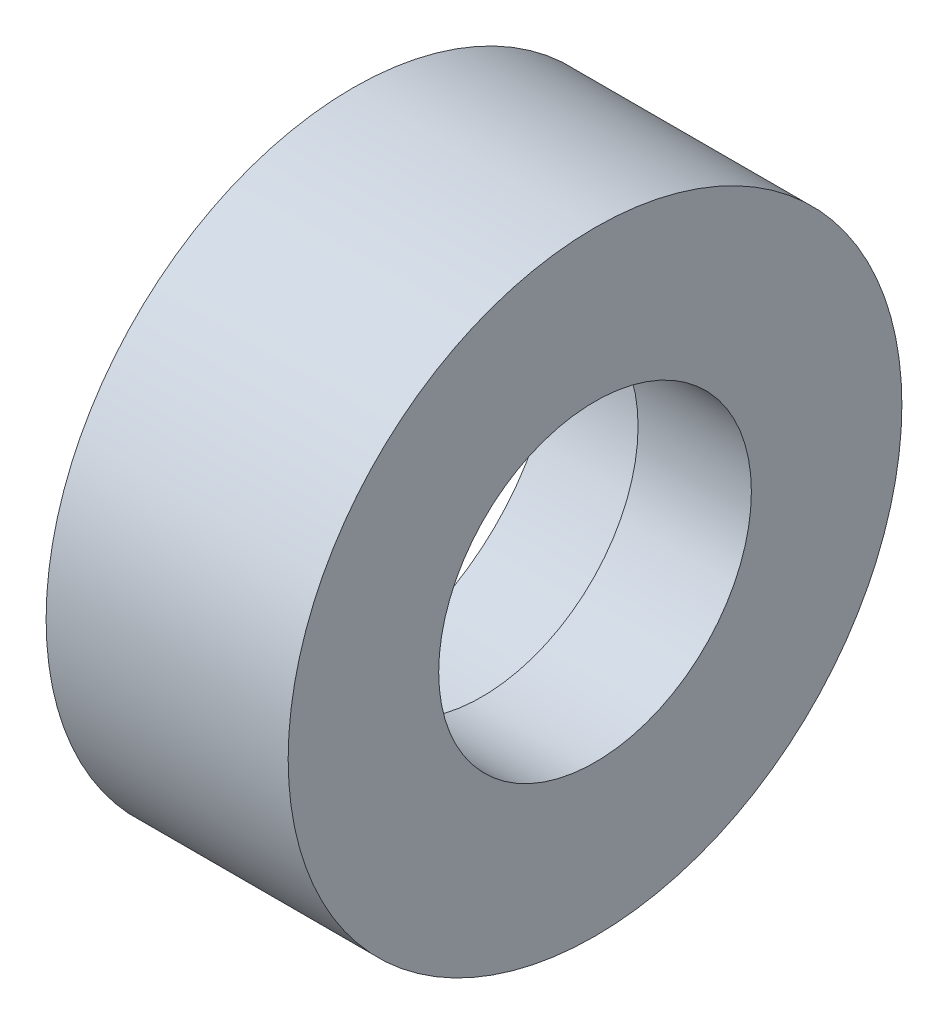
from build123d import *


with BuildPart() as part:
    # Skizze4 → Rotation1 (revolve)
    with BuildSketch(Plane.XY):
        Polygon((0, 11), (7, 11), (7, 8.5), (13.159430928, 8.5), (13.159430928, 16.683058648), (0, 16.683058648), align=None)
    revolve(axis=Axis((0, 0, 0), (1, 0, 0)))


solid = part.part
